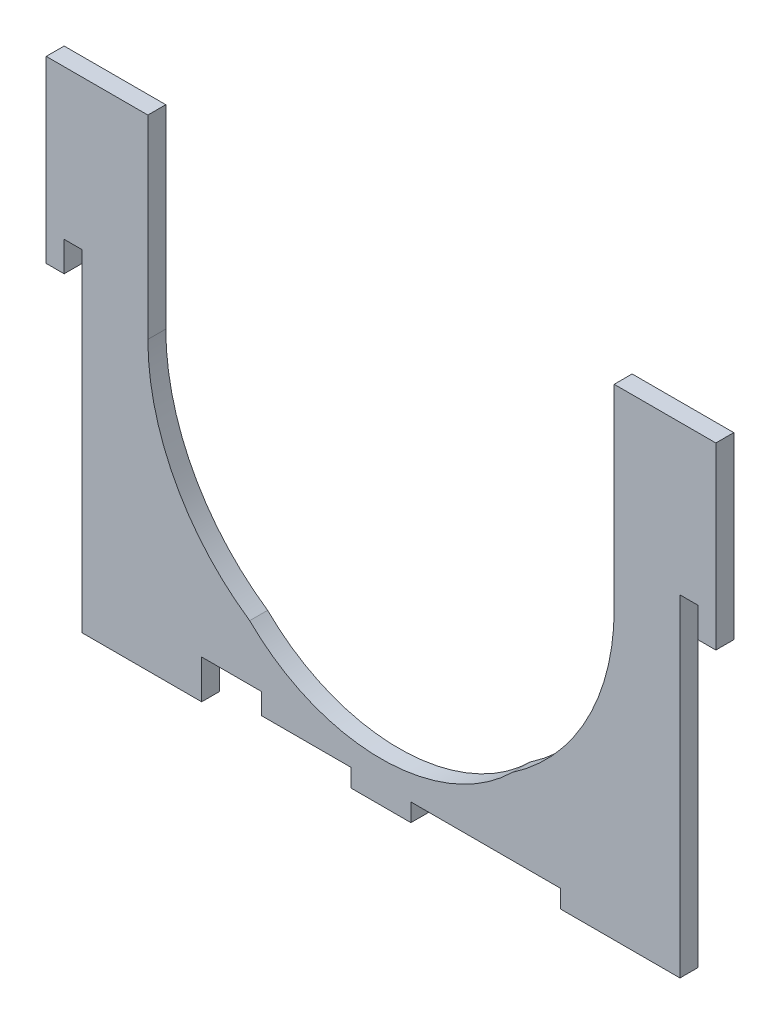
from build123d import *

# Parameters (mm, degrees)
BOSS_EXTRUDE1_DEPTH = 6
BOSS_EXTRUDE2_DEPTH = 6
SKETCH4_W           = 40
SKETCH4_H           = 6
SKETCH4_W_2         = 20
BOSS_EXTRUDE3_DEPTH = 6
SKETCH5_W           = 20
SKETCH5_H           = 7
CUT_EXTRUDE1_DEPTH  = 10


with BuildPart() as part:
    # Sketch1 → Boss-Extrude1 (new body)
    with BuildSketch(Plane.XY):
        with BuildLine():
            Line((-178, 90), (-178, 155))
            Line((-178, 155), (-200, 155))
            Line((-200, 155), (-200, 0))
            Line((-200, 0), (0, 0))
            Line((0, 0), (0, 155))
            Line((0, 155), (-22, 155))
            Line((-22, 155), (-22, 90))
            ThreePointArc((-22, 90), (-31.037807258, 53.555302549), (-56.056819802, 25.55625))
            ThreePointArc((-56.056819802, 25.55625), (-100, 7.5), (-143.943180198, 25.55625))
            ThreePointArc((-143.943180198, 25.55625), (-168.962192742, 53.555302549), (-178, 90))
        make_face()
    extrude(amount=BOSS_EXTRUDE1_DEPTH)

    # Sketch3 → Boss-Extrude2 (add)
    with BuildSketch(Plane.XY.offset(6)):
        Polygon((-200, 155), (-200, 105), (-206, 105), (-206, 95), (-212, 95), (-212, 155), align=None)
    boss_extrude2 = extrude(amount=-BOSS_EXTRUDE2_DEPTH)

    # Mirror1: Boss-Extrude2 across plane
    add(boss_extrude2.mirror(Plane.ZY.offset(100)))

    # Sketch4 → Boss-Extrude3 (add)
    with BuildSketch(Plane.XY.offset(6)):
        with Locations((-180, -3)):
            Rectangle(SKETCH4_W, SKETCH4_H)
        with Locations((-100, -3)):
            Rectangle(SKETCH4_W_2, SKETCH4_H)
        with Locations((-20, -3)):
            Rectangle(SKETCH4_W, SKETCH4_H)
    extrude(amount=-BOSS_EXTRUDE3_DEPTH)

    # Sketch5 → Cut-Extrude1 (cut)
    with BuildSketch(Plane.XY.offset(6)):
        with Locations((-150, 3.5)):
            Rectangle(SKETCH5_W, SKETCH5_H)
    extrude(amount=-CUT_EXTRUDE1_DEPTH, mode=Mode.SUBTRACT)


solid = part.part
